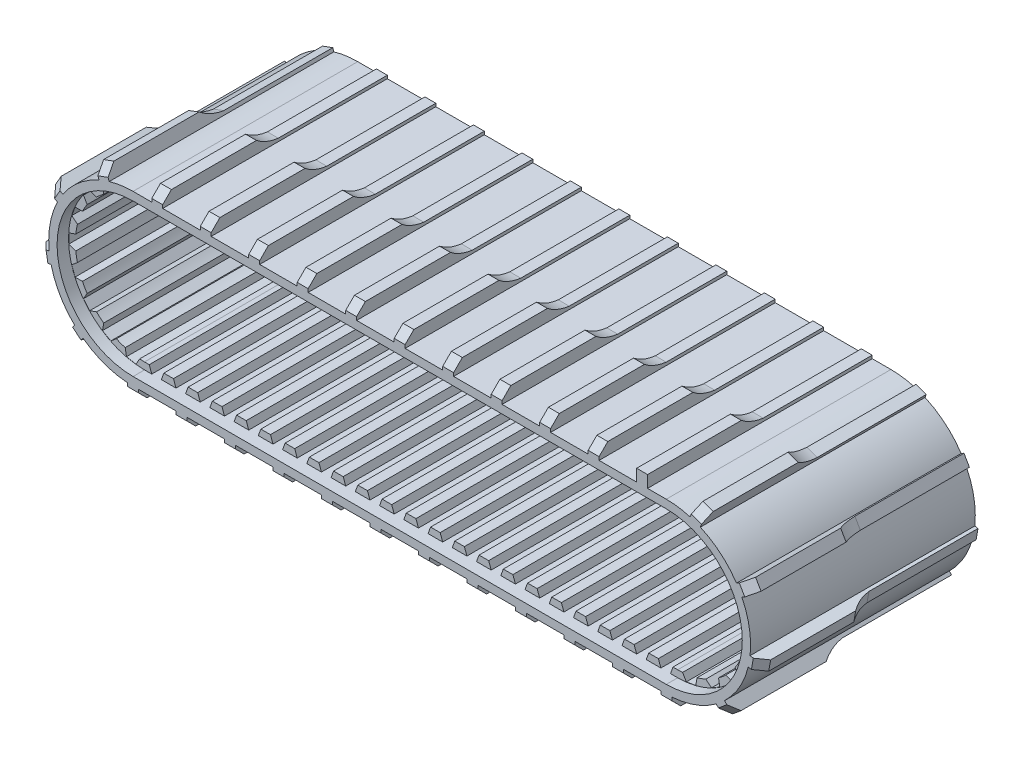
from build123d import *

# Parameters (mm, degrees)
EXTRUDE_THIN1_DEPTH = 206
CUT_EXTRUDE8_DEPTH  = 608.495548103
LPATTERN2_COUNT     = 22
LPATTERN2_PITCH     = 22.23
CUT_EXTRUDE9_DEPTH  = 608.495548103
CUT_EXTRUDE1_DEPTH  = 10.5
CUT_EXTRUDE2_START  = -22
CUT_EXTRUDE2_DEPTH  = 22
EXTRUDE1_DEPTH      = 206
CUT_EXTRUDE3_DEPTH  = 10
CIRPATTERN1_COUNT   = 5
CIRPATTERN1_ANGLE   = 159.72
EXTRUDE2_DEPTH      = 206
CUT_EXTRUDE4_DEPTH  = 10
CUT_EXTRUDE5_DEPTH  = 10
CIRPATTERN2_COUNT   = 5
CIRPATTERN2_ANGLE   = 159.72
SKETCH7_W           = 10
SKETCH7_H           = 11
EXTRUDE3_DEPTH      = 206
CUT_EXTRUDE6_DEPTH  = 434.6
CUT_EXTRUDE7_DEPTH  = 10
LPATTERN1_START     = -27.151894506
LPATTERN1_DEPTH     = 10
LPATTERN1_START_2   = -427.291894506
LPATTERN1_2_DEPTH   = 10
LPATTERN1_START_3   = -382.831894506
LPATTERN1_3_DEPTH   = 10
LPATTERN1_START_4   = -338.371894506
LPATTERN1_4_DEPTH   = 10
LPATTERN1_START_5   = -293.911894506
LPATTERN1_5_DEPTH   = 10
LPATTERN1_START_6   = -249.451894506
LPATTERN1_6_DEPTH   = 10
LPATTERN1_START_7   = -204.991894506
LPATTERN1_7_DEPTH   = 10
LPATTERN1_START_8   = -160.531894506
LPATTERN1_8_DEPTH   = 10
LPATTERN1_START_9   = -116.071894506
LPATTERN1_9_DEPTH   = 10
LPATTERN1_START_10  = -71.611894506
LPATTERN1_10_DEPTH  = 10
SKETCH19_W          = 10
SKETCH19_H          = 11
BOSS_EXTRUDE1_DEPTH = 206
CUT_EXTRUDE10_REACH = 584.12
LPATTERN3_COUNT     = 10
LPATTERN3_PITCH     = 44.46


# Read off the part's stored shape, not the designer's step: LPattern1
with BuildPart() as part:
    # Sketch2 → Extrude-Thin1 (new body)
    with BuildSketch(Plane.XY):
        with BuildLine():
            Line((-488.9, 77.344372204), (0, 77.344372204))
            ThreePointArc((0, 77.344372204), (77.344372204, 0), (0, -77.344372204))
            Line((0, -77.344372204), (-488.9, -77.344372204))
            ThreePointArc((-488.9, -77.344372204), (-566.244372204, 0), (-488.9, 77.344372204))
        make_face()
        with BuildLine():
            Line((-488.9, 63.344372204), (0, 63.344372204))
            ThreePointArc((0, 63.344372204), (63.344372204, 0), (0, -63.344372204))
            Line((0, -63.344372204), (-488.9, -63.344372204))
            ThreePointArc((-488.9, -63.344372204), (-552.244372204, 0), (-488.9, 63.344372204))
        make_face(mode=Mode.SUBTRACT)
    extrude(amount=EXTRUDE_THIN1_DEPTH)

    # Sketch15 → Cut-Extrude8 (cut, through all)
    with BuildSketch(Plane.XY.offset(206)):
        Polygon((-471.153789012, 63.344372204), (-473.465, 69.694372204), (-482.268789012, 69.694372204), (-484.58, 63.344372204), align=None)
        Polygon((-484.58, -63.344372204), (-471.153789012, -63.344372204), (-473.465, -69.694372204), (-482.268789012, -69.694372204), align=None)
    cut_extrude8 = extrude(amount=-CUT_EXTRUDE8_DEPTH, mode=Mode.SUBTRACT)

    # LPattern2: Cut-Extrude8 ×22
    with Locations(*[(i * LPATTERN2_PITCH, 0, 0) for i in range(1, LPATTERN2_COUNT)]):
        add(cut_extrude8, mode=Mode.SUBTRACT)

    # Sketch16 → Cut-Extrude9 (cut, through all)
    with BuildSketch(Plane.XY.offset(206)):
        Polygon((-496.77553848, 69.029427735), (-505.441782951, 67.479296207), (-506.598805708, 60.821556758), (-493.382356908, 63.185583534), align=None)
        Polygon((-514.687125645, 57.857874494), (-519.871715542, 62.191951538), (-527.487868445, 57.775967397), (-526.302133188, 51.123281614), align=None)
        Polygon((-532.892448885, 45.576023643), (-539.245292978, 47.879405539), (-544.895942058, 41.128341479), (-541.509966486, 35.280319108), align=None)
        Polygon((-545.810164675, 27.816229913), (-552.567692247, 27.812065074), (-555.573666081, 19.537355274), (-550.394422528, 15.19689073), align=None)
        Polygon((-551.887647238, 6.713105494), (-558.237647238, 4.401894506), (-558.237647238, -4.401894506), (-551.887647238, -6.713105494), align=None)
        Polygon((-550.394422528, -15.19689073), (-555.573666081, -19.537355274), (-552.567692247, -27.812065074), (-545.810164675, -27.816229913), align=None)
        Polygon((-541.509966486, -35.280319108), (-544.895942058, -41.128341479), (-539.245292978, -47.879405539), (-532.892448885, -45.576023643), align=None)
        Polygon((-526.302133188, -51.123281614), (-527.487868445, -57.775967397), (-519.871715542, -62.191951538), (-514.687125645, -57.857874494), align=None)
        Polygon((-506.598805708, -60.821556758), (-505.441782951, -67.479296207), (-496.77553848, -69.029427735), (-493.382356908, -63.185583534), align=None)
    cut_extrude9 = extrude(amount=-CUT_EXTRUDE9_DEPTH, mode=Mode.SUBTRACT)

    # Mirror1: Cut-Extrude9 across plane
    add(cut_extrude9.mirror(Plane(origin=(-244.45, 0, 0), x_dir=(0, 0, 1), z_dir=(1, 0, 0))), mode=Mode.SUBTRACT)

    # Sketch3 → Cut-Extrude1 (cut)
    with BuildSketch(Plane.XY.offset(206)):
        with BuildLine():
            Line((-488.9, -69.694372204), (0, -69.694372204))
            ThreePointArc((0, -69.694372204), (69.694372204, 0), (0, 69.694372204))
            Line((0, 69.694372204), (-488.9, 69.694372204))
            ThreePointArc((-488.9, 69.694372204), (-558.594372204, 0), (-488.9, -69.694372204))
        make_face()
    extrude(amount=-CUT_EXTRUDE1_DEPTH, mode=Mode.SUBTRACT)

    # Sketch8 → Cut-Extrude2 (cut)
    with BuildSketch(Plane(origin=(0, 0, 0), x_dir=(-1, 0, 0), z_dir=(0, 0, -1)).offset(CUT_EXTRUDE2_START)):
        with BuildLine():
            Line((0, -69.694372204), (488.9, -69.694372204))
            ThreePointArc((488.9, -69.694372204), (558.594372204, 0), (488.9, 69.694372204))
            Line((488.9, 69.694372204), (0, 69.694372204))
            ThreePointArc((0, 69.694372204), (-69.694372204, 0), (0, -69.694372204))
        make_face()
    extrude(amount=CUT_EXTRUDE2_DEPTH, mode=Mode.SUBTRACT)

    # Sketch4 → Extrude1 (add)
    with BuildSketch(Plane.XY.offset(206)):
        Polygon((-520.149154442, 70.750563661), (-510.759627946, 74.19102761), (-514.544138289, 84.519506755), (-523.933664785, 81.079042807), align=None)
    extrude1 = extrude(amount=-EXTRUDE1_DEPTH)

    # Sketch9 → Cut-Extrude3 (cut)
    with BuildSketch(Plane(origin=(-426.335159781, -156.215624697, 0), x_dir=(0, 0, -1), z_dir=(0.9389526496015795, 0.3440463948454822, 0))):
        Polygon((-206, 248.386870578), (-198, 256.386870578), (-206, 256.386870578), align=None)
        with BuildLine():
            Line((0, 248.386870578), (-100, 248.386870578))
            ThreePointArc((-100, 248.386870578), (-110.548647807, 251.01525106), (-120, 256.386870578))
            Line((-120, 256.386870578), (0, 256.386870578))
            Line((0, 256.386870578), (0, 248.386870578))
        make_face()
    cut_extrude3 = extrude(amount=-CUT_EXTRUDE3_DEPTH, mode=Mode.SUBTRACT)

    # CirPattern1: Extrude1, Cut-Extrude3 ×5 about axis
    cirpattern1_axis = Axis((-488.9, 0, 0), (0, 0, 1))
    add([extrude1.rotate(cirpattern1_axis, i * CIRPATTERN1_ANGLE / (CIRPATTERN1_COUNT - 1)) for i in range(1, CIRPATTERN1_COUNT)])
    add([cut_extrude3.rotate(cirpattern1_axis, i * CIRPATTERN1_ANGLE / (CIRPATTERN1_COUNT - 1)) for i in range(1, CIRPATTERN1_COUNT)], mode=Mode.SUBTRACT)

    # Sketch6 → Extrude2 (add)
    with BuildSketch(Plane.XY.offset(206)):
        Polygon((21.859627946, 74.19102761), (31.249154442, 70.750563661), (35.033664785, 81.079042807), (25.644138289, 84.519506755), align=None)
    extrude2 = extrude(amount=-EXTRUDE2_DEPTH)

    # Sketch10 → Cut-Extrude4 (cut)
    with BuildSketch(Plane(origin=(4.694763248, -1.720231974, 0), x_dir=(0, 0, -1), z_dir=(0.9389526496015931, -0.3440463948454452, 0))):
        Polygon((-206, 80.182588138), (-198, 88.182588138), (-206, 88.182588138), align=None)
    cut_extrude4 = extrude(amount=-CUT_EXTRUDE4_DEPTH, mode=Mode.SUBTRACT)

    # Sketch12 → Cut-Extrude5 (cut)
    with BuildSketch(Plane(origin=(4.694763248, -1.720231974, 0), x_dir=(0, 0, -1), z_dir=(0.9389526496015931, -0.3440463948454452, 0))):
        with BuildLine():
            Line((-100, 80.182588138), (0, 80.182588138))
            Line((0, 80.182588138), (0, 88.182588138))
            Line((0, 88.182588138), (-120, 88.182588138))
            ThreePointArc((-120, 88.182588138), (-110.548647807, 82.81096862), (-100, 80.182588138))
        make_face()
    cut_extrude5 = extrude(amount=-CUT_EXTRUDE5_DEPTH, mode=Mode.SUBTRACT)

    # CirPattern2: Extrude2, Cut-Extrude4, Cut-Extrude5 ×5 about axis
    cirpattern2_axis = Axis((0, 0, 0), (0, 0, -1))
    add([extrude2.rotate(cirpattern2_axis, i * CIRPATTERN2_ANGLE / (CIRPATTERN2_COUNT - 1)) for i in range(1, CIRPATTERN2_COUNT)])
    add([cut_extrude4.rotate(cirpattern2_axis, i * CIRPATTERN2_ANGLE / (CIRPATTERN2_COUNT - 1)) for i in range(1, CIRPATTERN2_COUNT)], mode=Mode.SUBTRACT)
    add([cut_extrude5.rotate(cirpattern2_axis, i * CIRPATTERN2_ANGLE / (CIRPATTERN2_COUNT - 1)) for i in range(1, CIRPATTERN2_COUNT)], mode=Mode.SUBTRACT)

    # Sketch7 → Extrude3 (add)
    with BuildSketch(Plane.XY.offset(206)):
        with Locations((-466.751894506, 82.844372204)):
            Rectangle(SKETCH7_W, SKETCH7_H)
    extrude(amount=-EXTRUDE3_DEPTH)

    # Sketch13 → Cut-Extrude6 (cut)
    with BuildSketch(Plane.ZY.offset(471.751894506)):
        Polygon((206, 80.344372204), (198, 88.344372204), (206, 88.344372204), align=None)
    extrude(amount=-CUT_EXTRUDE6_DEPTH, mode=Mode.SUBTRACT)

    # Sketch14 → Cut-Extrude7 (cut)
    with BuildSketch(Plane.ZY.offset(471.751894506)):
        with BuildLine():
            Line((0, 88.344372204), (0, 80.161230153))
            Line((0, 80.161230153), (100, 80.161230153))
            ThreePointArc((100, 80.161230153), (110.563066351, 82.876639437), (120, 88.344372204))
            Line((120, 88.344372204), (0, 88.344372204))
        make_face()
    extrude(amount=-CUT_EXTRUDE7_DEPTH, mode=Mode.SUBTRACT)

    # LPattern1 outline → LPattern1 (add)
    with BuildSketch(Plane.YZ.offset(LPATTERN1_START)):
        with BuildLine():
            ThreePointArc((80.161230153, 100), (82.876639437, 110.563066351), (88.344372204, 120))
            Line((88.344372204, 120), (88.344372204, 206))
            Line((88.344372204, 206), (77.344372204, 206))
            Line((77.344372204, 206), (77.344372204, 0))
            Line((77.344372204, 0), (80.161230153, 0))
            Line((80.161230153, 0), (80.161230153, 100))
        make_face()
    extrude(amount=LPATTERN1_DEPTH)

    # LPattern1 2 outline → LPattern1 2 (add)
    with BuildSketch(Plane.YZ.offset(LPATTERN1_START_2)):
        with BuildLine():
            ThreePointArc((80.161230153, 100), (82.876639437, 110.563066351), (88.344372204, 120))
            Line((88.344372204, 120), (88.344372204, 198))
            Line((88.344372204, 198), (80.344372204, 206))
            Line((80.344372204, 206), (77.344372204, 206))
            Line((77.344372204, 206), (77.344372204, 0))
            Line((77.344372204, 0), (80.161230153, 0))
            Line((80.161230153, 0), (80.161230153, 100))
        make_face()
    extrude(amount=LPATTERN1_2_DEPTH)

    # LPattern1 3 outline → LPattern1 3 (add)
    with BuildSketch(Plane.YZ.offset(LPATTERN1_START_3)):
        with BuildLine():
            ThreePointArc((80.161230153, 100), (82.876639437, 110.563066351), (88.344372204, 120))
            Line((88.344372204, 120), (88.344372204, 198))
            Line((88.344372204, 198), (80.344372204, 206))
            Line((80.344372204, 206), (77.344372204, 206))
            Line((77.344372204, 206), (77.344372204, 0))
            Line((77.344372204, 0), (80.161230153, 0))
            Line((80.161230153, 0), (80.161230153, 100))
        make_face()
    extrude(amount=LPATTERN1_3_DEPTH)

    # LPattern1 4 outline → LPattern1 4 (add)
    with BuildSketch(Plane.YZ.offset(LPATTERN1_START_4)):
        with BuildLine():
            ThreePointArc((80.161230153, 100), (82.876639437, 110.563066351), (88.344372204, 120))
            Line((88.344372204, 120), (88.344372204, 198))
            Line((88.344372204, 198), (80.344372204, 206))
            Line((80.344372204, 206), (77.344372204, 206))
            Line((77.344372204, 206), (77.344372204, 0))
            Line((77.344372204, 0), (80.161230153, 0))
            Line((80.161230153, 0), (80.161230153, 100))
        make_face()
    extrude(amount=LPATTERN1_4_DEPTH)

    # LPattern1 5 outline → LPattern1 5 (add)
    with BuildSketch(Plane.YZ.offset(LPATTERN1_START_5)):
        with BuildLine():
            ThreePointArc((80.161230153, 100), (82.876639437, 110.563066351), (88.344372204, 120))
            Line((88.344372204, 120), (88.344372204, 198))
            Line((88.344372204, 198), (80.344372204, 206))
            Line((80.344372204, 206), (77.344372204, 206))
            Line((77.344372204, 206), (77.344372204, 0))
            Line((77.344372204, 0), (80.161230153, 0))
            Line((80.161230153, 0), (80.161230153, 100))
        make_face()
    extrude(amount=LPATTERN1_5_DEPTH)

    # LPattern1 6 outline → LPattern1 6 (add)
    with BuildSketch(Plane.YZ.offset(LPATTERN1_START_6)):
        with BuildLine():
            ThreePointArc((80.161230153, 100), (82.876639437, 110.563066351), (88.344372204, 120))
            Line((88.344372204, 120), (88.344372204, 198))
            Line((88.344372204, 198), (80.344372204, 206))
            Line((80.344372204, 206), (77.344372204, 206))
            Line((77.344372204, 206), (77.344372204, 0))
            Line((77.344372204, 0), (80.161230153, 0))
            Line((80.161230153, 0), (80.161230153, 100))
        make_face()
    extrude(amount=LPATTERN1_6_DEPTH)

    # LPattern1 7 outline → LPattern1 7 (add)
    with BuildSketch(Plane.YZ.offset(LPATTERN1_START_7)):
        with BuildLine():
            ThreePointArc((80.161230153, 100), (82.876639437, 110.563066351), (88.344372204, 120))
            Line((88.344372204, 120), (88.344372204, 198))
            Line((88.344372204, 198), (80.344372204, 206))
            Line((80.344372204, 206), (77.344372204, 206))
            Line((77.344372204, 206), (77.344372204, 0))
            Line((77.344372204, 0), (80.161230153, 0))
            Line((80.161230153, 0), (80.161230153, 100))
        make_face()
    extrude(amount=LPATTERN1_7_DEPTH)

    # LPattern1 8 outline → LPattern1 8 (add)
    with BuildSketch(Plane.YZ.offset(LPATTERN1_START_8)):
        with BuildLine():
            ThreePointArc((80.161230153, 100), (82.876639437, 110.563066351), (88.344372204, 120))
            Line((88.344372204, 120), (88.344372204, 198))
            Line((88.344372204, 198), (80.344372204, 206))
            Line((80.344372204, 206), (77.344372204, 206))
            Line((77.344372204, 206), (77.344372204, 0))
            Line((77.344372204, 0), (80.161230153, 0))
            Line((80.161230153, 0), (80.161230153, 100))
        make_face()
    extrude(amount=LPATTERN1_8_DEPTH)

    # LPattern1 9 outline → LPattern1 9 (add)
    with BuildSketch(Plane.YZ.offset(LPATTERN1_START_9)):
        with BuildLine():
            ThreePointArc((80.161230153, 100), (82.876639437, 110.563066351), (88.344372204, 120))
            Line((88.344372204, 120), (88.344372204, 198))
            Line((88.344372204, 198), (80.344372204, 206))
            Line((80.344372204, 206), (77.344372204, 206))
            Line((77.344372204, 206), (77.344372204, 0))
            Line((77.344372204, 0), (80.161230153, 0))
            Line((80.161230153, 0), (80.161230153, 100))
        make_face()
    extrude(amount=LPATTERN1_9_DEPTH)

    # LPattern1 10 outline → LPattern1 10 (add)
    with BuildSketch(Plane.YZ.offset(LPATTERN1_START_10)):
        with BuildLine():
            ThreePointArc((80.161230153, 100), (82.876639437, 110.563066351), (88.344372204, 120))
            Line((88.344372204, 120), (88.344372204, 198))
            Line((88.344372204, 198), (80.344372204, 206))
            Line((80.344372204, 206), (77.344372204, 206))
            Line((77.344372204, 206), (77.344372204, 0))
            Line((77.344372204, 0), (80.161230153, 0))
            Line((80.161230153, 0), (80.161230153, 100))
        make_face()
    extrude(amount=LPATTERN1_10_DEPTH)

    # Sketch19 → Boss-Extrude1 (add, through all)
    with BuildSketch(Plane.XY.offset(206)):
        with Locations((-444.521894506, -82.844372204)):
            Rectangle(SKETCH19_W, SKETCH19_H)
    boss_extrude1 = extrude(amount=-BOSS_EXTRUDE1_DEPTH)

    # Sketch20 → Cut-Extrude10 (cut, up to next)
    with BuildSketch(Plane.ZY.offset(449.521894506), mode=Mode.PRIVATE) as cut_extrude10_sk1:
        Polygon((206, -80.344372204), (198, -88.344372204), (206, -88.344372204), align=None)
    cut_extrude10_tool1 = extrude(cut_extrude10_sk1.sketch, amount=-CUT_EXTRUDE10_REACH, mode=Mode.PRIVATE) & part.part
    # Sketch20 → Cut-Extrude10 (cut, up to next)
    with BuildSketch(Plane.ZY.offset(449.521894506), mode=Mode.PRIVATE) as cut_extrude10_sk2:
        with BuildLine():
            Line((0, -80.344372204), (96, -80.344372204))
            ThreePointArc((96, -80.344372204), (108.649110641, -82.397040282), (120, -88.344372204))
            Line((120, -88.344372204), (0, -88.344372204))
            Line((0, -88.344372204), (0, -80.344372204))
        make_face()
    cut_extrude10_tool2 = extrude(cut_extrude10_sk2.sketch, amount=-CUT_EXTRUDE10_REACH, mode=Mode.PRIVATE) & part.part
    cut_extrude10_1 = cut_extrude10_tool1.solids().sort_by_distance((-449.521895, -85.677706, 203.333333))[0]
    add(cut_extrude10_1, mode=Mode.SUBTRACT)
    cut_extrude10_2 = cut_extrude10_tool2.solids().sort_by_distance((-449.521895, -84.456557, 56.314533))[0]
    add(cut_extrude10_2, mode=Mode.SUBTRACT)
    cut_extrude10 = cut_extrude10_1 + cut_extrude10_2  # Cut-Extrude10 as one shape, for the pattern or mirror that repeats it

    # LPattern3: Boss-Extrude1, Cut-Extrude10 ×10
    with Locations(*[(i * LPATTERN3_PITCH, 0, 0) for i in range(1, LPATTERN3_COUNT)]):
        add(boss_extrude1)
        add(cut_extrude10, mode=Mode.SUBTRACT)


solid = part.part
